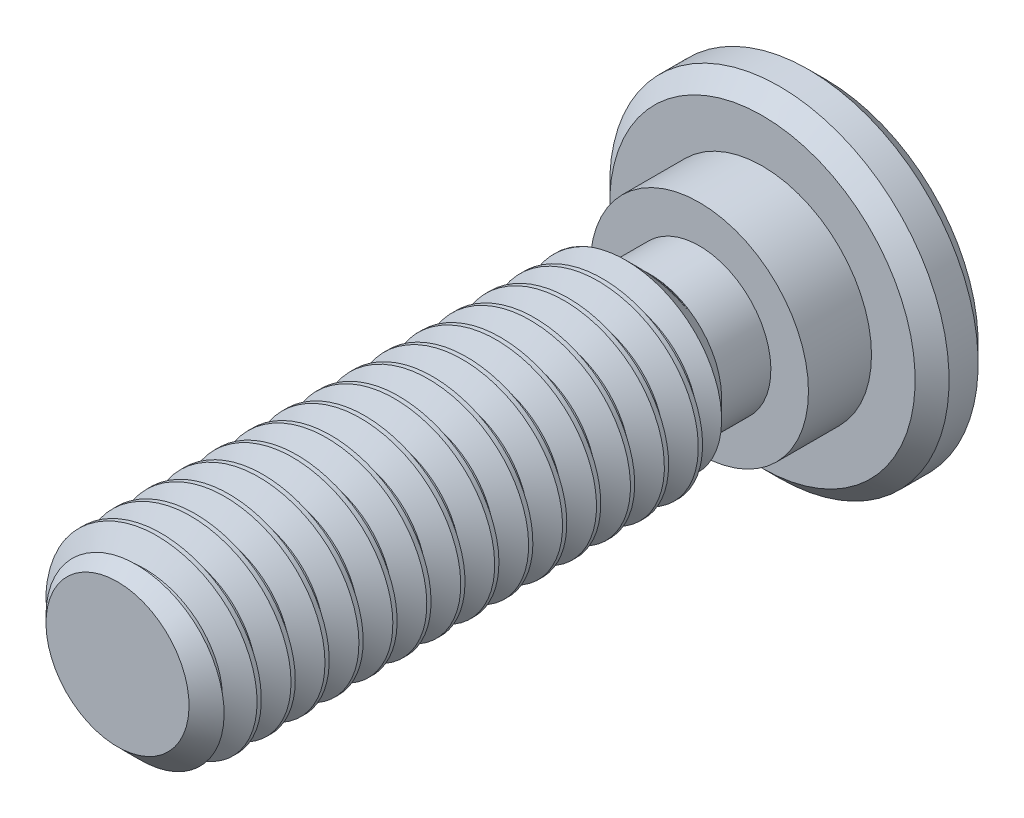
from build123d import *

# Parameters (mm, degrees)
CHAMFER2_SIZE      = 0.525
CUT_EXTRUDE1_DEPTH = 1.875
CHAMFER1_SIZE      = 0.35
CUT_SWEEP1_PITCH   = 0.7


with BuildPart() as part:
    # Sketch13 → Revolve1 (revolve)
    with BuildSketch(Plane(origin=(0, 0, 0), x_dir=(0, 0, -1), z_dir=(1, 0, 0)), mode=Mode.PRIVATE) as revolve1_sk:
        Polygon((1.3, 3.5), (0, 3.5), (0, 2.25), (-1.3, 2.25), (-1.3, 1.475), (-2.316, 1.475), (-2.841, 2), (-13.3, 2), (-13.3, 0), (1.3, 0), align=None)
    revolve(revolve1_sk.sketch.rotate(Axis((0, 0, 13.3), (0, 0, -1)), 180), axis=Axis((0, 0, 13.3), (0, 0, -1)))

    # Chamfer2
    chamfer2_edges = [part.edges().sort_by_distance(p)[0] for p in [
        (0, 2, 13.3),
    ]]
    chamfer(chamfer2_edges, length=CHAMFER2_SIZE)

    # Sketch7 → Cut-Extrude1 (cut)
    with BuildSketch(Plane(origin=(0, 0, -1.3), x_dir=(-1, 0, 0), z_dir=(0, 0, -1))):
        Polygon((0, 1.443375673), (-1.25, 0.721687836), (-1.25, -0.721687836), (0, -1.443375673), (1.25, -0.721687836), (1.25, 0.721687836), align=None)
    extrude(amount=-CUT_EXTRUDE1_DEPTH, mode=Mode.SUBTRACT)

    # Chamfer1
    chamfer1_edges = [part.edges().sort_by_distance(p)[0] for p in [
        (0, 3.5, 0),
        (0, 3.5, -1.3),
    ]]
    chamfer(chamfer1_edges, length=CHAMFER1_SIZE)

    # Cut-Extrude2 cone 1 section (through the dimple's axis) → Cut-Extrude2 (revolve, cut)
    with BuildSketch(Plane(origin=(0, 0, -1.3), x_dir=(0, 1, 0), z_dir=(1, 0, 0))):
        Polygon((0, 0), (1.443375673, 0), (0, 1.443375673), align=None)
    revolve(axis=Axis((0, 0, -1.3), (0, 0, 1)), mode=Mode.SUBTRACT)

    # Cut-Sweep1: the profile of Sketch3 screwed along a right-hand helix of 17 turns, 6 arcs to a turn; built about Z, then put on its axis
    cut_sweep1_z = Axis((0, 0, 0), (0, 0, 1))
    cut_sweep1_corners = [(2.037888611, 0, -0.634375), (2.037888611, 0, 0.021875), (1.545336663, 0, -0.2625), (1.545336663, 0, -0.35)]
    with BuildLine(mode=Mode.PRIVATE) as cut_sweep1_profile:
        Line(cut_sweep1_corners[0], cut_sweep1_corners[1])
        Line(cut_sweep1_corners[1], cut_sweep1_corners[2])
        Line(cut_sweep1_corners[2], cut_sweep1_corners[3])
        Line(cut_sweep1_corners[3], cut_sweep1_corners[0])
    cut_sweep1_cap = Face(cut_sweep1_profile.wire())
    cut_sweep1_turn_angles = [0, 30, 60, 90, 120, 150, 180, 210, 240, 270, 300, 330, 360]
    cut_sweep1_turn_weights = [1, 0.8660254037844387, 1, 0.8660254037844387, 1, 0.8660254037844387, 1, 0.8660254037844387, 1, 0.8660254037844387, 1, 0.8660254037844387, 1]
    cut_sweep1_turn_rails = [Edge.make_bspline([Vector(p[0], p[1], 0).rotate(cut_sweep1_z, cut_sweep1_turn_angles[k]) / cut_sweep1_turn_weights[k] + Vector(0, 0, p[2] + CUT_SWEEP1_PITCH * cut_sweep1_turn_angles[k] / 360) for k in range(13)], [0, 0, 0, 1, 1, 2, 2, 3, 3, 4, 4, 5, 5, 6, 6, 6], 2, cut_sweep1_turn_weights) for p in cut_sweep1_corners]
    cut_sweep1_turn_sides = [Face.make_surface_from_curves(cut_sweep1_turn_rails[p[0]], cut_sweep1_turn_rails[p[1]]) for p in [(0, 1), (1, 2), (2, 3), (3, 0)]]
    cut_sweep1 = Plane(origin=(0, 0, 13.3), x_dir=(0, 1, 0), z_dir=(0, 0, -1)) * Solid(Shell([*[p.moved(Location((0, 0, CUT_SWEEP1_PITCH * i))) for i in range(17) for p in cut_sweep1_turn_sides], cut_sweep1_cap, cut_sweep1_cap.rotate(cut_sweep1_z, 6120).moved(Location((0, 0, CUT_SWEEP1_PITCH * 6120 / 360)))]))
    add(cut_sweep1, mode=Mode.SUBTRACT)


solid = part.part
